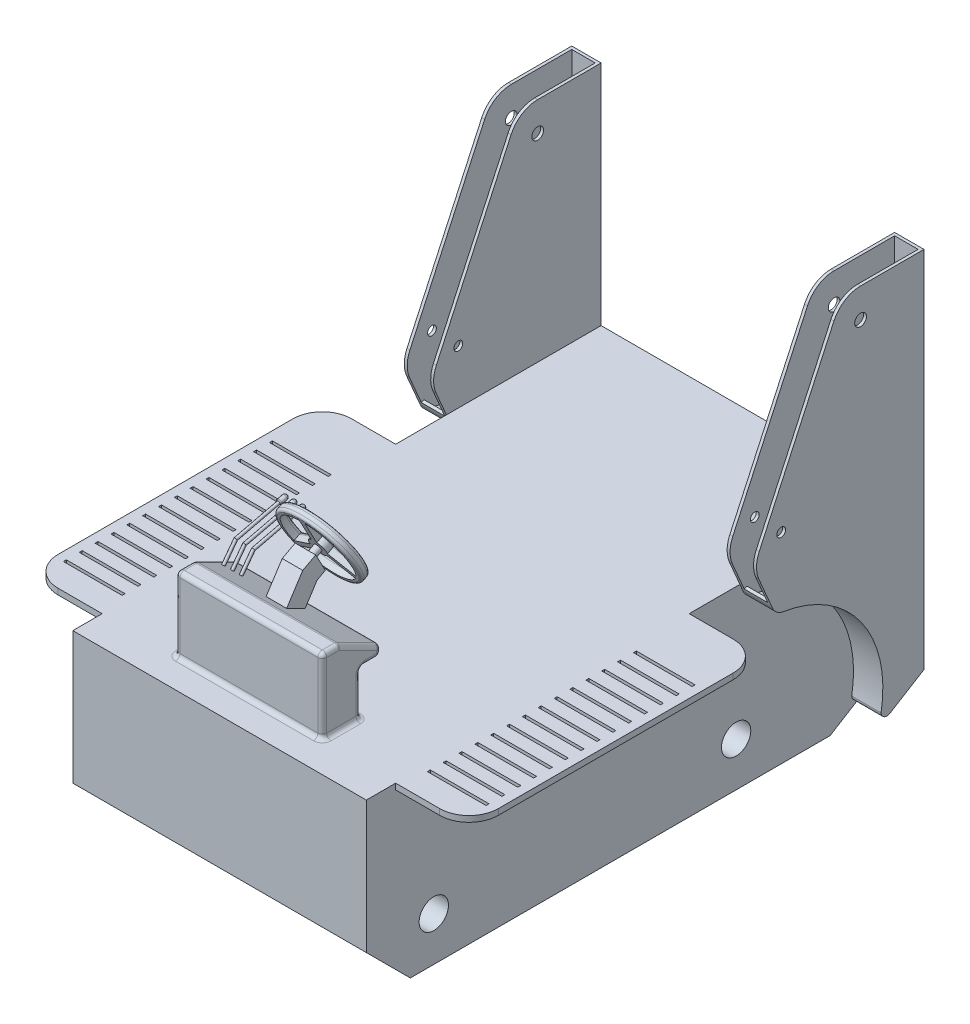
from build123d import *

# Parameters (mm, degrees)
SKETCH1_R            = 50
BOSS_EXTRUDE1_DEPTH  = 500
BOSS_EXTRUDE2_DEPTH  = 10
BOSS_EXTRUDE3_DEPTH  = 80
BOSS_EXTRUDE4_START  = 90
BOSS_EXTRUDE4_DEPTH  = 10
SKETCH4_R            = 20
SKETCH4_R_2          = 15
CUT_EXTRUDE1_DEPTH   = 2051.573090626
BOSS_EXTRUDE5_DEPTH  = 20
SKETCH6_W            = 200
SKETCH6_H            = 10
CUT_EXTRUDE2_DEPTH   = 1428.357698687
LPATTERN1_COUNT      = 14
LPATTERN1_PITCH      = 54
SKETCH7_W            = 500
SKETCH7_H            = 200
BOSS_EXTRUDE6_DEPTH  = 253
SKETCH8_W            = 70
SKETCH8_H            = 150
CUT_EXTRUDE3_DEPTH   = 1941.322138203
FILLET1_R            = 15
SKETCH10_R           = 5
SKETCH11_R           = 8.5
BOSS_EXTRUDE7_DEPTH  = 30
FILLET2_R            = 8.5
FILLET3_R            = 3.5
LPATTERN2_COUNT      = 3
LPATTERN2_PITCH      = 30
BOSS_EXTRUDE8_DEPTH  = 35
SKETCH13_R           = 12.5
BOSS_EXTRUDE9_DEPTH  = 30
SKETCH14_R           = 135
BOSS_EXTRUDE10_DEPTH = 30
FILLET4_R            = 9


with BuildPart() as part:
    # Sketch1 → Boss-Extrude1 (new, symmetric)
    with BuildSketch(Plane(origin=(0, 0, 0), x_dir=(0, 0, -1), z_dir=(1, 0, 0))):
        Polygon((-865, 600), (935, 600), (935, 135), (715, 0), (-715, 0), (-865, 150), align=None)
        with Locations((-635, 150)):
            Circle(SKETCH1_R, mode=Mode.SUBTRACT)
        with Locations((395, 150)):
            Circle(SKETCH1_R, mode=Mode.SUBTRACT)
    extrude(amount=BOSS_EXTRUDE1_DEPTH, both=True)

    # Sketch5 → Boss-Extrude5 (add)
    with BuildSketch(Plane(origin=(0, 600, 0), x_dir=(1, 0, 0), z_dir=(0, 1, 0))):
        with BuildLine():
            Line((500, 235), (650, 235))
            ThreePointArc((650, 235), (720.710678119, 205.710678119), (750, 135))
            Line((750, 135), (750, -665))
            ThreePointArc((750, -665), (720.710678119, -735.710678119), (650, -765))
            Line((650, -765), (500, -765))
            Line((500, -765), (500, 235))
        make_face()
        with BuildLine():
            Line((-750, 135), (-750, -665))
            ThreePointArc((-750, -665), (-720.710678119, -735.710678119), (-650, -765))
            Line((-650, -765), (-500, -765))
            Line((-500, -765), (-500, 235))
            Line((-500, 235), (-650, 235))
            ThreePointArc((-650, 235), (-720.710678119, 205.710678119), (-750, 135))
        make_face()
    extrude(amount=-BOSS_EXTRUDE5_DEPTH)

    # Sketch6 → Cut-Extrude2 (cut, through all)
    with BuildSketch(Plane(origin=(0, 600, 0), x_dir=(1, 0, 0), z_dir=(0, 1, 0))):
        with Locations((620, 30)):
            Rectangle(SKETCH6_W, SKETCH6_H)
        with Locations((-620, 30)):
            Rectangle(SKETCH6_W, SKETCH6_H)
    cut_extrude2 = extrude(amount=-CUT_EXTRUDE2_DEPTH, mode=Mode.SUBTRACT)

    # LPattern1: Cut-Extrude2 ×14
    with Locations(*[(0, 0, i * LPATTERN1_PITCH) for i in range(1, LPATTERN1_COUNT)]):
        add(cut_extrude2, mode=Mode.SUBTRACT)

    # Sketch7 → Boss-Extrude6 (add)
    with BuildSketch(Plane(origin=(0, 600, 0), x_dir=(1, 0, 0), z_dir=(0, 1, 0))):
        with Locations((0, -665)):
            Rectangle(SKETCH7_W, SKETCH7_H)
    extrude(amount=BOSS_EXTRUDE6_DEPTH)

    # Sketch8 → Cut-Extrude3 (cut, through all)
    with BuildSketch(Plane(origin=(250, 0, 0), x_dir=(0, 0, -1), z_dir=(1, 0, 0))):
        Polygon((-705, 853), (-565, 853), (-565, 783), align=None)
        with Locations((-600, 675)):
            Rectangle(SKETCH8_W, SKETCH8_H)
    extrude(amount=-CUT_EXTRUDE3_DEPTH, mode=Mode.SUBTRACT)

    # Fillet1
    fillet1_edges = [part.edges().sort_by_distance(p)[0] for p in [
        (250, 600, 700),
        (250, 726.5, 765),
        (0, 600, 765),
        (-250, 726.5, 765),
        (250, 853, 735),
        (0, 853, 765),
        (-250, 853, 735),
        (0, 853, 705),
        (-250, 600, 700),
        (-250, 766.5, 565),
        (-250, 675, 635),
        (-250, 750, 600),
        (250, 766.5, 565),
        (-250, 818, 635),
        (0, 783, 565),
        (250, 818, 635),
        (0, 750, 635),
        (0, 750, 565),
        (0, 600, 635),
        (250, 750, 600),
        (250, 675, 635),
    ]]
    fillet(fillet1_edges, radius=FILLET1_R)

    # Sketch12 → Boss-Extrude8 (add, symmetric)
    with BuildSketch(Plane(origin=(0, 0, 0), x_dir=(0, 0, -1), z_dir=(1, 0, 0))):
        Polygon((-671.422291236, 836.211145618), (-616.498315752, 920.971731488), (-572.374385653, 944.489358763), (-539.449707469, 882.715856624), (-567.597923668, 867.713130087), (-608.422488501, 804.71124425), align=None)
    extrude(amount=BOSS_EXTRUDE8_DEPTH, both=True)

    # Sketch13 → Boss-Extrude9 (add)
    with BuildSketch(Plane(origin=(0, -28.628089325, 53.712213291), x_dir=(-1, 0, 0), z_dir=(0, 0.4703525454873195, -0.8824786019805803))):
        with Locations(Location((0, 1067.70939817, 0), (0, 0, 90))):
            Circle(SKETCH13_R)
    extrude(amount=BOSS_EXTRUDE9_DEPTH)

    # Sketch14 → Boss-Extrude10 (add)
    with BuildSketch(Plane(origin=(0, -14.517512961, 27.237855232), x_dir=(-1, 0, 0), z_dir=(0, 0.4703525454873196, -0.8824786019805801))):
        with Locations(Location((0, 1067.70939817, 0), (0, 0, 90))):
            Circle(SKETCH14_R)
        with BuildLine():
            Line((-9, 1184.362730742), (-9, 1096.327574213))
            ThreePointArc((-9, 1096.327574213), (-25.980762114, 1082.70939817), (-29.284067463, 1061.194538783))
            Line((-29.284067463, 1061.194538783), (-105.524749443, 1017.176960519))
            ThreePointArc((-105.524749443, 1017.176960519), (-101.324972243, 1126.20939817), (-9, 1184.362730742))
        make_face(mode=Mode.SUBTRACT)
        with BuildLine():
            Line((9, 1184.362730742), (9, 1096.327574213))
            ThreePointArc((9, 1096.327574213), (25.980762114, 1082.70939817), (29.284067463, 1061.194538783))
            Line((29.284067463, 1061.194538783), (105.524749443, 1017.176960519))
            ThreePointArc((105.524749443, 1017.176960519), (101.324972243, 1126.20939817), (9, 1184.362730742))
        make_face(mode=Mode.SUBTRACT)
        with BuildLine():
            Line((96.524749443, 1001.58850325), (20.284067463, 1045.606081515))
            ThreePointArc((20.284067463, 1045.606081515), (0, 1037.70939817), (-20.284067463, 1045.606081515))
            Line((-20.284067463, 1045.606081515), (-96.524749443, 1001.58850325))
            ThreePointArc((-96.524749443, 1001.58850325), (0, 950.70939817), (96.524749443, 1001.58850325))
        make_face(mode=Mode.SUBTRACT)
    extrude(amount=BOSS_EXTRUDE10_DEPTH)

    # Fillet4
    fillet4_edges = [part.edges().sort_by_distance(p)[0] for p in [
        (0, 822.689149155, 439.465736802),
        (0, 808.578572791, 465.940094861),
        (-25.980762114, 955.060939452, 510.018618625),
        (-67.404408453, 916.652250954, 489.547159755),
        (-101.324972243, 993.448758638, 530.478954353),
        (-9, 1005.923259337, 537.127742374),
        (0, 838.573763991, 447.93208262),
        (-58.404408453, 902.895770977, 482.215089199),
        (0, 915.349402363, 488.852754078),
        (58.404408453, 902.895770977, 482.215089199),
        (101.324972243, 993.448758638, 530.478954353),
        (67.404408453, 916.652250954, 489.547159755),
        (25.980762114, 955.060939452, 510.018618625),
        (9, 1005.923259337, 537.127742374),
    ]]
    fillet(fillet4_edges, radius=FILLET4_R - 0.0001)  # a hair under: the kernel refuses the full size


with BuildPart() as body_2:
    # Sketch2 → Boss-Extrude2 (new body)
    with BuildSketch(Plane(origin=(500, 0, 0), x_dir=(0, 0, -1), z_dir=(1, 0, 0))):
        with BuildLine():
            Line((935, 135), (935, 1375))
            Line((935, 1375), (719.046420048, 1375))
            ThreePointArc((719.046420048, 1375), (665.113322029, 1359.20938747), (628.212957077, 1316.824418761))
            Line((628.212957077, 1316.824418761), (373.587493201, 763.833765708))
            ThreePointArc((373.587493201, 763.833765708), (364.429813626, 723.340291143), (372.50645317, 682.617417089))
            Line((372.50645317, 682.617417089), (418.67812534, 574.883515358))
            ThreePointArc((418.67812534, 574.883515358), (433.954375956, 555.099407026), (456.898112747, 545.181760255))
            ThreePointArc((456.898112747, 545.181760255), (720.449587024, 382.556587321), (788.921846668, 80.533614479))
            ThreePointArc((788.921846668, 80.533614479), (799.392493797, 63.506228056), (819.374309575, 64.047871785))
            Line((819.374309575, 64.047871785), (935, 135))
        make_face()
    extrude(amount=BOSS_EXTRUDE2_DEPTH)

    # Sketch3 → Boss-Extrude3 (add)
    with BuildSketch(Plane(origin=(510, 0, 0), x_dir=(0, 0, -1), z_dir=(1, 0, 0))):
        with BuildLine():
            Line((935, 135), (935, 1375))
            Line((935, 1375), (925, 1375))
            Line((925, 1375), (925, 140.596281363))
            Line((925, 140.596281363), (814.144147377, 72.571099071))
            ThreePointArc((814.144147377, 72.571099071), (804.525733933, 72.108601512), (798.976448501, 79.978367224))
            ThreePointArc((798.976448501, 79.978367224), (728.236828809, 388.858150217), (458.445565566, 555.061304261))
            ThreePointArc((458.445565566, 555.061304261), (440.090576133, 562.995421678), (427.86957564, 578.822708344))
            Line((427.86957564, 578.822708344), (421.819653651, 592.939192986))
            Line((421.819653651, 592.939192986), (412.628203351, 589))
            Line((412.628203351, 589), (418.67812534, 574.883515358))
            ThreePointArc((418.67812534, 574.883515358), (433.954375956, 555.099407026), (456.898112747, 545.181760255))
            ThreePointArc((456.898112747, 545.181760255), (720.449587024, 382.556587321), (788.921846668, 80.533614479))
            ThreePointArc((788.921846668, 80.533614479), (799.392493797, 63.506228056), (819.374309575, 64.047871785))
            Line((819.374309575, 64.047871785), (935, 135))
        make_face()
    extrude(amount=BOSS_EXTRUDE3_DEPTH)

    # Sketch2<3> → Boss-Extrude4 (add)
    with BuildSketch(Plane(origin=(500, 0, 0), x_dir=(0, 0, -1), z_dir=(1, 0, 0)).offset(BOSS_EXTRUDE4_START)):
        with BuildLine():
            Line((935, 135), (935, 1375))
            Line((935, 1375), (719.046420048, 1375))
            ThreePointArc((719.046420048, 1375), (665.113322029, 1359.20938747), (628.212957077, 1316.824418761))
            Line((628.212957077, 1316.824418761), (373.587493201, 763.833765708))
            ThreePointArc((373.587493201, 763.833765708), (364.429813626, 723.340291143), (372.50645317, 682.617417089))
            Line((372.50645317, 682.617417089), (418.67812534, 574.883515358))
            ThreePointArc((418.67812534, 574.883515358), (433.954375956, 555.099407026), (456.898112747, 545.181760255))
            ThreePointArc((456.898112747, 545.181760255), (720.449587024, 382.556587321), (788.921846668, 80.533614479))
            ThreePointArc((788.921846668, 80.533614479), (799.392493797, 63.506228056), (819.374309575, 64.047871785))
            Line((819.374309575, 64.047871785), (935, 135))
        make_face()
    extrude(amount=BOSS_EXTRUDE4_DEPTH)


with BuildPart() as body_3:
    # Mirror1: mirrored copy
    add(body_2.part.mirror(Plane(origin=(0, 0, 0), x_dir=(0, 0, 1), z_dir=(1, 0, 0))))


with BuildPart() as cut_extrude1_tool:
    # Sketch4 → Cut-Extrude1 (new, through all)
    with BuildSketch(Plane(origin=(600, 0, 0), x_dir=(0, 0, -1), z_dir=(1, 0, 0))):
        with Locations((719.046420048, 1275)):
            Circle(SKETCH4_R)
        with Locations((448.624256806, 783.340291143)):
            Circle(SKETCH4_R_2)
    extrude(amount=-CUT_EXTRUDE1_DEPTH)


with BuildPart() as body_2_1:
    add(body_2.part)

    # Cut-Extrude1: cut by cut_extrude1_tool
    add(cut_extrude1_tool.part, mode=Mode.SUBTRACT)


with BuildPart() as body_3_1:
    add(body_3.part)

    # Cut-Extrude1: cut by cut_extrude1_tool
    add(cut_extrude1_tool.part, mode=Mode.SUBTRACT)


with BuildPart() as body_4:
    # Sweep1: sweep along a path in Sketch9
    with BuildLine(Plane.ZY.offset(220)) as sweep1_path:
        Line((631.547682167, 816.273841083), (589.846227416, 872.496511525))
        Line((589.846227416, 872.496511525), (443.951076789, 907.347695489))
    # Sketch10 → Sweep1 (sweep)
    with BuildSketch(Plane(origin=(-220, 907.347695489, 443.951076789), x_dir=(-1, 0, 0), z_dir=(0, 0.23234122642147464, -0.9726343375107447))):
        Circle(SKETCH10_R)
    sweep(path=sweep1_path.line, transition=Transition.RIGHT)

    # Sketch11 → Boss-Extrude7 (add)
    with BuildSketch(Plane(origin=(0, -51.344573014, 214.940307958), x_dir=(-1, 0, 0), z_dir=(0, 0.23234122642147462, -0.9726343375107447))):
        with Locations(Location((220, 985.665662346, 0), (0, 0, 90))):
            Circle(SKETCH11_R)
    extrude(amount=BOSS_EXTRUDE7_DEPTH)

    # Fillet2
    fillet2_edges = [body_4.edges().sort_by_distance(p)[0] for p in [
        (-220, 906.050540412, 412.797146239),
    ]]
    fillet(fillet2_edges, radius=FILLET2_R)

    # Fillet3
    fillet3_edges = [body_4.edges().sort_by_distance(p)[0] for p in [
        (-220, 899.08030362, 441.976176364),
    ]]
    fillet(fillet3_edges, radius=FILLET3_R - 0.0001)  # a hair under: the kernel refuses the full size


with BuildPart() as lpattern2_1:
    # LPattern2: pattern copy
    add(body_4.part.moved(Location(Vector(1, 0, 0) * (1 * LPATTERN2_PITCH))))


with BuildPart() as lpattern2_2:
    # LPattern2: pattern copy
    add(body_4.part.moved(Location(Vector(1, 0, 0) * (2 * LPATTERN2_PITCH))))


solid = Compound([part.part, body_2_1.part, body_3_1.part, body_4.part, lpattern2_1.part, lpattern2_2.part])
